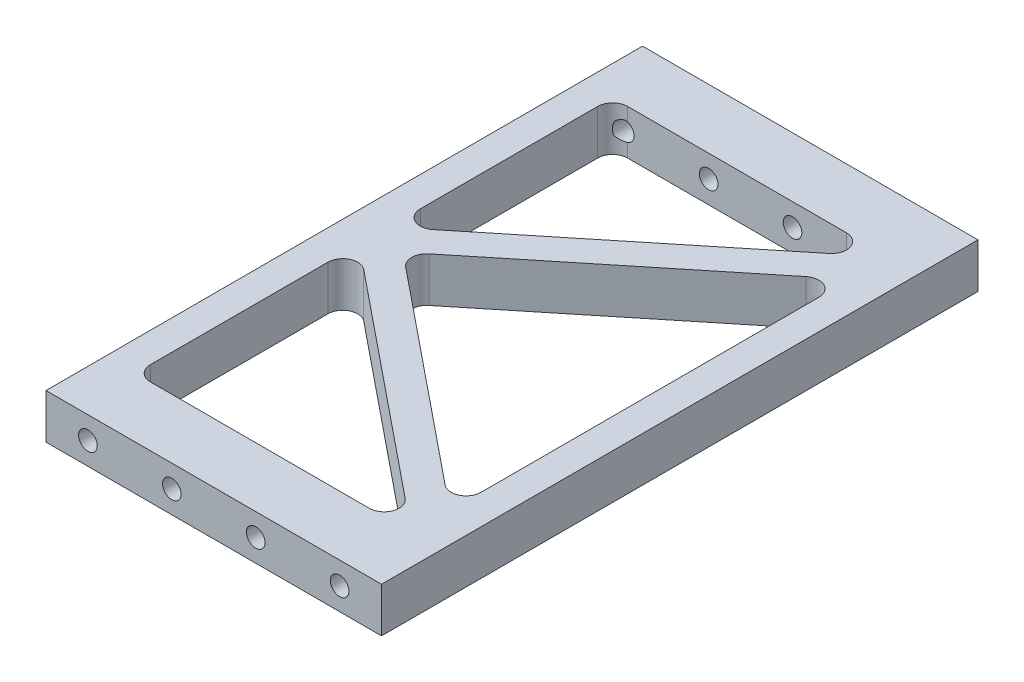
from build123d import *

# Parameters (mm, degrees)
SKETCH_1_W          = 45
SKETCH_1_H          = 80
EXTRUDE_1_DEPTH     = 6
CUT_EXTRUDE_2_DEPTH = 84.320165626
FILLET_10_R         = 2
M3X0_52_D           = 2.5
M3X0_52_DEPTH       = 8.5
M3X0_52_TIP         = 0.751075774
M3X0_51_D           = 2.5
M3X0_51_DEPTH       = 8.5
M3X0_51_TIP         = 0.751075774


with BuildPart() as part:
    # Эскиз1 → Бобышка-Вытянуть1 (new body)
    with BuildSketch(Plane(origin=(0, 0, 0), x_dir=(1, 0, 0), z_dir=(0, 1, 0))):
        with Locations((0, -40)):
            Rectangle(SKETCH_1_W, SKETCH_1_H)
    extrude(amount=EXTRUDE_1_DEPTH)

    # Эскиз13 → Вырез-Вытянуть2 (cut, through all)
    with BuildSketch(Plane(origin=(0, 6, 0), x_dir=(1, 0, 0), z_dir=(0, 1, 0))):
        Polygon((-18.5, -8), (18.5, -8), (-18.5, -38), align=None)
        Polygon((18.5, -72), (-18.5, -42), (-18.5, -72), align=None)
        Polygon((18.5, -13.149623941), (-14.615463806, -40), (18.5, -66.850376059), align=None)
    extrude(amount=-CUT_EXTRUDE_2_DEPTH, mode=Mode.SUBTRACT)

    # Скругление10
    fillet_10_edges = [part.edges().sort_by_distance(p)[0] for p in [
        (-14.615463806, 3, 40),
        (18.5, 3, 13.149623941),
        (18.5, 3, 66.850376059),
        (18.5, 3, 72),
        (-18.5, 3, 72),
        (-18.5, 3, 42),
        (18.5, 3, 8),
        (-18.5, 3, 8),
        (-18.5, 3, 38),
    ]]
    fillet(fillet_10_edges, radius=FILLET_10_R)

    # Отверстие обработанное метчиком M3x0.52
    with Locations(Plane(origin=(0, 0, 0), x_dir=(-1, 0, 0), z_dir=(0, 0, -1))):
        with Locations((-16.875, 3), (-5.625, 3), (5.625, 3), (16.875, 3)):
            Hole(M3X0_52_D / 2, depth=M3X0_52_DEPTH)
            with Locations((0, 0, -(M3X0_52_DEPTH + M3X0_52_TIP / 2))):  # 118° drill point
                Cone(0, M3X0_52_D / 2, M3X0_52_TIP, mode=Mode.SUBTRACT)

    # Отверстие обработанное метчиком M3x0.51
    with Locations(Plane.XY.offset(80)):
        with Locations((-16.875, 3), (-5.625, 3), (5.625, 3), (16.875, 3)):
            Hole(M3X0_51_D / 2, depth=M3X0_51_DEPTH)
            with Locations((0, 0, -(M3X0_51_DEPTH + M3X0_51_TIP / 2))):  # 118° drill point
                Cone(0, M3X0_51_D / 2, M3X0_51_TIP, mode=Mode.SUBTRACT)


solid = part.part
